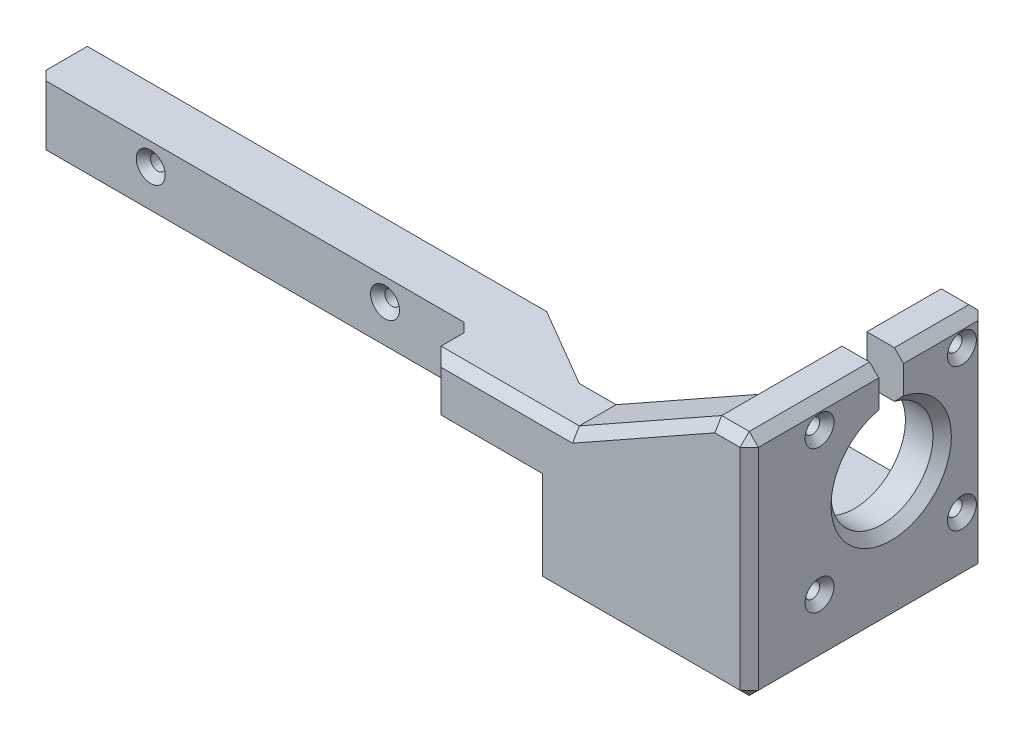
from build123d import *

# Parameters (mm, degrees)
SKETCH1_W           = 100
SKETCH1_H           = 13
SKETCH1_R           = 1.6
BOSS_EXTRUDE1_DEPTH = 10
SKETCH2_R           = 1.6
BOSS_EXTRUDE2_DEPTH = 10
SKETCH4_R           = 1.6
SKETCH4_R_2         = 11.1
BOSS_EXTRUDE3_DEPTH = 8
SKETCH5_W           = 47
SKETCH5_H           = 51.8
BOSS_EXTRUDE4_DEPTH = 8
SKETCH6_W           = 39
SKETCH6_H           = 11.35
BOSS_EXTRUDE5_DEPTH = 10
BOSS_EXTRUDE6_DEPTH = 8
SKETCH8_W           = 10
SKETCH8_H           = 10
BOSS_EXTRUDE7_DEPTH = 2.15
CHAMFER1_SIZE2      = 17.09924405
CHAMFER1_SIZE       = 10
CHAMFER3_SIZE       = 2
CHAMFER4_SIZE       = 3
CHAMFER5_SIZE       = 1.55
SKETCH9_W           = 95
SKETCH9_H           = 9
CUT_EXTRUDE1_DEPTH  = 126.670601176
CHAMFER6_SIZE       = 1.55
CHAMFER7_SIZE       = 2
SKETCH11_W          = 47
SKETCH11_H          = 8
CUT_EXTRUDE3_DEPTH  = 132.535746092
CUT_EXTRUDE4_DEPTH  = 170.481709928
CHAMFER9_SIZE       = 2


# Some blends are built 0.0001 mm under size
with BuildPart() as part:
    # Sketch1 → Boss-Extrude1 (new body)
    with BuildSketch(Plane.XY):
        Rectangle(SKETCH1_W, SKETCH1_H)
        with Locations((25.8, 1.7)):
            Circle(SKETCH1_R, mode=Mode.SUBTRACT)
        with Locations((-25.2, 1.7)):
            Circle(SKETCH1_R, mode=Mode.SUBTRACT)
    extrude(amount=BOSS_EXTRUDE1_DEPTH)

    # Sketch2 → Boss-Extrude2 (add)
    with BuildSketch(Plane.XY.offset(10)):
        Polygon((50, -6.5), (106.1, -6.5), (106.1, 6.5), (50, 6.5), (-50, 6.5), (-50, -6.5), align=None)
        with Locations((25.8, 1.7)):
            Circle(SKETCH2_R, mode=Mode.SUBTRACT)
        with Locations((-25.2, 1.7)):
            Circle(SKETCH2_R, mode=Mode.SUBTRACT)
    extrude(amount=BOSS_EXTRUDE2_DEPTH)

    # Sketch4 → Boss-Extrude3 (add)
    with BuildSketch(Plane(origin=(106.1, 0, 0), x_dir=(0, 0, -1), z_dir=(1, 0, 0))):
        Polygon((-20, -6.5), (-20, -17.85), (31.8, -17.85), (31.8, 23.95), (-20, 23.95), align=None)
        with Locations((-4.7, 18.55)):
            Circle(SKETCH4_R, mode=Mode.SUBTRACT)
        with Locations(Location((26.3, 18.55, 0), (0, 0, 180))):
            Circle(SKETCH4_R, mode=Mode.SUBTRACT)
        with Locations((26.3, -12.45)):
            Circle(SKETCH4_R, mode=Mode.SUBTRACT)
        with Locations(Location((-4.7, -12.45, 0), (0, 0, 180))):
            Circle(SKETCH4_R, mode=Mode.SUBTRACT)
        with Locations((10.9, 3.05)):
            Circle(SKETCH4_R_2, mode=Mode.SUBTRACT)
    extrude(amount=BOSS_EXTRUDE3_DEPTH)

    # Sketch5 → Boss-Extrude4 (add)
    with BuildSketch(Plane.XZ.offset(17.85)):
        with Locations((90.6, -5.9)):
            Rectangle(SKETCH5_W, SKETCH5_H)
    extrude(amount=BOSS_EXTRUDE4_DEPTH)

    # Sketch6 → Boss-Extrude5 (add)
    with BuildSketch(Plane.XY.offset(20)):
        Polygon((106.1, 23.95), (75.1, 6.5), (106.1, 6.5), align=None)
        with Locations((86.6, -12.175)):
            Rectangle(SKETCH6_W, SKETCH6_H)
    extrude(amount=-BOSS_EXTRUDE5_DEPTH)

    # Sketch7 → Boss-Extrude6 (add)
    with BuildSketch(Plane(origin=(0, 0, -31.8), x_dir=(-1, 0, 0), z_dir=(0, 0, -1))):
        Polygon((-67.1, -17.85), (-67.1, -6.5), (-67.1, 1.996774194), (-106.1, 23.95), (-114.1, 23.95), (-114.1, -25.85), (-67.1, -25.85), align=None)
    extrude(amount=BOSS_EXTRUDE6_DEPTH)

    # Sketch8 → Boss-Extrude7 (add)
    with BuildSketch(Plane.XZ.offset(25.85)):
        with Locations((78.85, 7.05)):
            Rectangle(SKETCH8_W, SKETCH8_H)
        with Locations((102.35, 7.05)):
            Rectangle(SKETCH8_W, SKETCH8_H)
        with Locations((102.35, -18.85)):
            Rectangle(SKETCH8_W, SKETCH8_H)
        with Locations((78.85, -18.85)):
            Rectangle(SKETCH8_W, SKETCH8_H)
    extrude(amount=BOSS_EXTRUDE7_DEPTH)

    # Chamfer1
    chamfer1_edges = [part.edges().sort_by_distance(p)[0] for p in [
        (50, 0, 10),
    ]]
    chamfer1_side = [part.faces().sort_by_distance(p)[0] for p in [
        (50, 0, 9.8),
    ]]
    chamfer(chamfer1_edges, length=CHAMFER1_SIZE - 0.0001, length2=CHAMFER1_SIZE2 - 0.0001, reference=chamfer1_side[0])  # a hair under: the kernel refuses the full size

    # Chamfer3
    chamfer3_edges = [part.edges().sort_by_distance(p)[0] for p in [
        (86.6, 12.973387097, -39.8),
        (110.1, 23.95, -39.8),
        (114.1, -0.95, -39.8),
        (90.6, -25.85, -39.8),
        (-50, 0, 20),
        (114.1, -0.95, 20),
        (114.1, 23.95, -9.9),
        (110.1, 23.95, 20),
        (114.1, 3.05, 0.2),
        (67.1, -16.175, 20),
        (114.1, -25.85, -9.9),
        (90.6, -25.85, 20),
    ]]
    chamfer(chamfer3_edges, length=CHAMFER3_SIZE)

    # Chamfer4
    # the kernel refuses this chamfer: 3 mm, written as the material it takes off along each edge
    with BuildSketch(Plane(origin=(115.065048964, -28, 2.05), x_dir=(0, -0.027495876610586775, 0.9996219169112968), z_dir=(-1, 0, 0))) as chamfer4_piece_1_section:
        Polygon((CHAMFER4_SIZE * 0.999621916911, CHAMFER4_SIZE * 0.0274958766106), (-CHAMFER4_SIZE * 0.0274958766106, CHAMFER4_SIZE * 0.999621916911), (0, 0), align=None)
    chamfer4_piece_1 = extrude(amount=25.430097928, mode=Mode.PRIVATE)
    chamfer4_piece_1 = split(chamfer4_piece_1, bisect_by=Plane(origin=(102.35, -25.85, 3.119652888), z_dir=(0, -1, 0)), keep=Keep.TOP, mode=Mode.PRIVATE)
    add(chamfer4_piece_1, mode=Mode.SUBTRACT)
    with BuildSketch(Plane(origin=(97.35, -28, -5.665048964), x_dir=(0.9996219169112965, -0.02749587661058676, 0), z_dir=(0, 0, 1))) as chamfer4_piece_2_section:
        Polygon((CHAMFER4_SIZE * 0.999621916911, CHAMFER4_SIZE * 0.0274958766106), (-CHAMFER4_SIZE * 0.0274958766106, CHAMFER4_SIZE * 0.999621916911), (0, 0), align=None)
    chamfer4_piece_2 = extrude(amount=25.430097928, mode=Mode.PRIVATE)
    chamfer4_piece_2 = split(chamfer4_piece_2, bisect_by=Plane(origin=(98.419652888, -25.85, 7.05), z_dir=(0, -1, 0)), keep=Keep.TOP, mode=Mode.PRIVATE)
    add(chamfer4_piece_2, mode=Mode.SUBTRACT)
    with BuildSketch(Plane(origin=(89.634951036, -28, 12.05), x_dir=(0, -0.02749587661058678, -0.9996219169112968), z_dir=(1, 0, 0))) as chamfer4_piece_3_section:
        Polygon((CHAMFER4_SIZE * 0.999621916911, CHAMFER4_SIZE * 0.0274958766106), (-CHAMFER4_SIZE * 0.0274958766106, CHAMFER4_SIZE * 0.999621916911), (0, 0), align=None)
    chamfer4_piece_3 = extrude(amount=25.430097928, mode=Mode.PRIVATE)
    chamfer4_piece_3 = split(chamfer4_piece_3, bisect_by=Plane(origin=(102.35, -25.85, 10.980347112), z_dir=(0, -1, 0)), keep=Keep.TOP, mode=Mode.PRIVATE)
    add(chamfer4_piece_3, mode=Mode.SUBTRACT)
    with BuildSketch(Plane(origin=(107.35, -28, 19.765048964), x_dir=(0.027495876610586768, 0.9996219169112968, 0), z_dir=(0, 0, -1))) as chamfer4_piece_4_section:
        Polygon((CHAMFER4_SIZE * 0.999621916911, -CHAMFER4_SIZE * 0.0274958766106), (-CHAMFER4_SIZE * 0.0274958766106, -CHAMFER4_SIZE * 0.999621916911), (0, 0), align=None)
    chamfer4_piece_4 = extrude(amount=25.430097928, mode=Mode.PRIVATE)
    chamfer4_piece_4 = split(chamfer4_piece_4, bisect_by=Plane(origin=(106.280347112, -25.85, 7.05), z_dir=(0, -1, 0)), keep=Keep.TOP, mode=Mode.PRIVATE)
    add(chamfer4_piece_4, mode=Mode.SUBTRACT)
    with BuildSketch(Plane(origin=(91.565048964, -28, 2.05), x_dir=(0, -0.027495876610586775, 0.9996219169112968), z_dir=(-1, 0, 0))) as chamfer4_piece_5_section:
        Polygon((CHAMFER4_SIZE * 0.999621916911, CHAMFER4_SIZE * 0.0274958766106), (-CHAMFER4_SIZE * 0.0274958766106, CHAMFER4_SIZE * 0.999621916911), (0, 0), align=None)
    chamfer4_piece_5 = extrude(amount=25.430097928, mode=Mode.PRIVATE)
    chamfer4_piece_5 = split(chamfer4_piece_5, bisect_by=Plane(origin=(78.85, -25.85, 3.119652888), z_dir=(0, -1, 0)), keep=Keep.TOP, mode=Mode.PRIVATE)
    add(chamfer4_piece_5, mode=Mode.SUBTRACT)
    with BuildSketch(Plane(origin=(73.85, -28, -5.665048964), x_dir=(-0.027495876610586768, 0.9996219169112968, 0), z_dir=(0, 0, 1))) as chamfer4_piece_6_section:
        Polygon((CHAMFER4_SIZE * 0.999621916911, -CHAMFER4_SIZE * 0.0274958766106), (-CHAMFER4_SIZE * 0.0274958766106, -CHAMFER4_SIZE * 0.999621916911), (0, 0), align=None)
    chamfer4_piece_6 = extrude(amount=25.430097928, mode=Mode.PRIVATE)
    chamfer4_piece_6 = split(chamfer4_piece_6, bisect_by=Plane(origin=(74.919652888, -25.85, 7.05), z_dir=(0, -1, 0)), keep=Keep.TOP, mode=Mode.PRIVATE)
    add(chamfer4_piece_6, mode=Mode.SUBTRACT)
    with BuildSketch(Plane(origin=(66.134951036, -28, 12.05), x_dir=(0, -0.02749587661058678, -0.9996219169112968), z_dir=(1, 0, 0))) as chamfer4_piece_7_section:
        Polygon((CHAMFER4_SIZE * 0.999621916911, CHAMFER4_SIZE * 0.0274958766106), (-CHAMFER4_SIZE * 0.0274958766106, CHAMFER4_SIZE * 0.999621916911), (0, 0), align=None)
    chamfer4_piece_7 = extrude(amount=25.430097928, mode=Mode.PRIVATE)
    chamfer4_piece_7 = split(chamfer4_piece_7, bisect_by=Plane(origin=(78.85, -25.85, 10.980347112), z_dir=(0, -1, 0)), keep=Keep.TOP, mode=Mode.PRIVATE)
    add(chamfer4_piece_7, mode=Mode.SUBTRACT)
    with BuildSketch(Plane(origin=(83.85, -28, 19.765048964), x_dir=(-0.9996219169112965, -0.02749587661058676, 0), z_dir=(0, 0, -1))) as chamfer4_piece_8_section:
        Polygon((CHAMFER4_SIZE * 0.999621916911, CHAMFER4_SIZE * 0.0274958766106), (-CHAMFER4_SIZE * 0.0274958766106, CHAMFER4_SIZE * 0.999621916911), (0, 0), align=None)
    chamfer4_piece_8 = extrude(amount=25.430097928, mode=Mode.PRIVATE)
    chamfer4_piece_8 = split(chamfer4_piece_8, bisect_by=Plane(origin=(82.780347112, -25.85, 7.05), z_dir=(0, -1, 0)), keep=Keep.TOP, mode=Mode.PRIVATE)
    add(chamfer4_piece_8, mode=Mode.SUBTRACT)
    with BuildSketch(Plane(origin=(97.35, -28, -6.134951036), x_dir=(0.9996219169112965, -0.02749587661058676, 0), z_dir=(0, 0, -1))) as chamfer4_piece_9_section:
        Polygon((CHAMFER4_SIZE * 0.999621916911, -CHAMFER4_SIZE * 0.0274958766106), (-CHAMFER4_SIZE * 0.0274958766106, -CHAMFER4_SIZE * 0.999621916911), (0, 0), align=None)
    chamfer4_piece_9 = extrude(amount=25.430097928, mode=Mode.PRIVATE)
    chamfer4_piece_9 = split(chamfer4_piece_9, bisect_by=Plane(origin=(98.419652888, -25.85, -18.85), z_dir=(0, -1, 0)), keep=Keep.TOP, mode=Mode.PRIVATE)
    add(chamfer4_piece_9, mode=Mode.SUBTRACT)
    with BuildSketch(Plane(origin=(115.065048964, -28, -13.85), x_dir=(0, -0.027495876610586768, -0.9996219169112968), z_dir=(-1, 0, 0))) as chamfer4_piece_10_section:
        Polygon((CHAMFER4_SIZE * 0.999621916911, -CHAMFER4_SIZE * 0.0274958766106), (-CHAMFER4_SIZE * 0.0274958766106, -CHAMFER4_SIZE * 0.999621916911), (0, 0), align=None)
    chamfer4_piece_10 = extrude(amount=25.430097928, mode=Mode.PRIVATE)
    chamfer4_piece_10 = split(chamfer4_piece_10, bisect_by=Plane(origin=(102.35, -25.85, -14.919652888), z_dir=(0, -1, 0)), keep=Keep.TOP, mode=Mode.PRIVATE)
    add(chamfer4_piece_10, mode=Mode.SUBTRACT)
    with BuildSketch(Plane(origin=(107.35, -28, -31.565048964), x_dir=(0.027495876610586768, 0.9996219169112968, 0), z_dir=(0, 0, 1))) as chamfer4_piece_11_section:
        Polygon((CHAMFER4_SIZE * 0.999621916911, CHAMFER4_SIZE * 0.0274958766106), (-CHAMFER4_SIZE * 0.0274958766106, CHAMFER4_SIZE * 0.999621916911), (0, 0), align=None)
    chamfer4_piece_11 = extrude(amount=25.430097928, mode=Mode.PRIVATE)
    chamfer4_piece_11 = split(chamfer4_piece_11, bisect_by=Plane(origin=(106.280347112, -25.85, -18.85), z_dir=(0, -1, 0)), keep=Keep.TOP, mode=Mode.PRIVATE)
    add(chamfer4_piece_11, mode=Mode.SUBTRACT)
    with BuildSketch(Plane(origin=(89.634951036, -28, -23.85), x_dir=(0, -0.027495876610586768, 0.9996219169112968), z_dir=(1, 0, 0))) as chamfer4_piece_12_section:
        Polygon((CHAMFER4_SIZE * 0.999621916911, -CHAMFER4_SIZE * 0.0274958766106), (-CHAMFER4_SIZE * 0.0274958766106, -CHAMFER4_SIZE * 0.999621916911), (0, 0), align=None)
    chamfer4_piece_12 = extrude(amount=25.430097928, mode=Mode.PRIVATE)
    chamfer4_piece_12 = split(chamfer4_piece_12, bisect_by=Plane(origin=(102.35, -25.85, -22.780347112), z_dir=(0, -1, 0)), keep=Keep.TOP, mode=Mode.PRIVATE)
    add(chamfer4_piece_12, mode=Mode.SUBTRACT)
    with BuildSketch(Plane(origin=(66.134951036, -28, -13.85), x_dir=(0, -0.027495876610586768, -0.9996219169112968), z_dir=(1, 0, 0))) as chamfer4_piece_13_section:
        Polygon((CHAMFER4_SIZE * 0.999621916911, CHAMFER4_SIZE * 0.0274958766106), (-CHAMFER4_SIZE * 0.0274958766106, CHAMFER4_SIZE * 0.999621916911), (0, 0), align=None)
    chamfer4_piece_13 = extrude(amount=25.430097928, mode=Mode.PRIVATE)
    chamfer4_piece_13 = split(chamfer4_piece_13, bisect_by=Plane(origin=(78.85, -25.85, -14.919652888), z_dir=(0, -1, 0)), keep=Keep.TOP, mode=Mode.PRIVATE)
    add(chamfer4_piece_13, mode=Mode.SUBTRACT)
    with BuildSketch(Plane(origin=(83.85, -28, -6.134951036), x_dir=(-0.9996219169112965, -0.02749587661058676, 0), z_dir=(0, 0, -1))) as chamfer4_piece_14_section:
        Polygon((CHAMFER4_SIZE * 0.999621916911, CHAMFER4_SIZE * 0.0274958766106), (-CHAMFER4_SIZE * 0.0274958766106, CHAMFER4_SIZE * 0.999621916911), (0, 0), align=None)
    chamfer4_piece_14 = extrude(amount=25.430097928, mode=Mode.PRIVATE)
    chamfer4_piece_14 = split(chamfer4_piece_14, bisect_by=Plane(origin=(82.780347112, -25.85, -18.85), z_dir=(0, -1, 0)), keep=Keep.TOP, mode=Mode.PRIVATE)
    add(chamfer4_piece_14, mode=Mode.SUBTRACT)
    with BuildSketch(Plane(origin=(91.565048964, -28, -23.85), x_dir=(0, -0.027495876610586768, 0.9996219169112968), z_dir=(-1, 0, 0))) as chamfer4_piece_15_section:
        Polygon((CHAMFER4_SIZE * 0.999621916911, CHAMFER4_SIZE * 0.0274958766106), (-CHAMFER4_SIZE * 0.0274958766106, CHAMFER4_SIZE * 0.999621916911), (0, 0), align=None)
    chamfer4_piece_15 = extrude(amount=25.430097928, mode=Mode.PRIVATE)
    chamfer4_piece_15 = split(chamfer4_piece_15, bisect_by=Plane(origin=(78.85, -25.85, -22.780347112), z_dir=(0, -1, 0)), keep=Keep.TOP, mode=Mode.PRIVATE)
    add(chamfer4_piece_15, mode=Mode.SUBTRACT)
    with BuildSketch(Plane(origin=(73.85, -28, -31.565048964), x_dir=(-0.027495876610586768, 0.9996219169112968, 0), z_dir=(0, 0, 1))) as chamfer4_piece_16_section:
        Polygon((CHAMFER4_SIZE * 0.999621916911, -CHAMFER4_SIZE * 0.0274958766106), (-CHAMFER4_SIZE * 0.0274958766106, -CHAMFER4_SIZE * 0.999621916911), (0, 0), align=None)
    chamfer4_piece_16 = extrude(amount=25.430097928, mode=Mode.PRIVATE)
    chamfer4_piece_16 = split(chamfer4_piece_16, bisect_by=Plane(origin=(74.919652888, -25.85, -18.85), z_dir=(0, -1, 0)), keep=Keep.TOP, mode=Mode.PRIVATE)
    add(chamfer4_piece_16, mode=Mode.SUBTRACT)

    # Chamfer5
    chamfer5_edges = [part.edges().sort_by_distance(p)[0] for p in [
        (114.1, 18.55, 6.3),
        (114.1, 18.55, -27.9),
        (114.1, -12.45, -24.7),
        (114.1, -12.45, 3.1),
    ]]
    chamfer(chamfer5_edges, length=CHAMFER5_SIZE)

    # Sketch9 → Cut-Extrude1 (cut, through all)
    with BuildSketch(Plane(origin=(0, 6.5, 0), x_dir=(1, 0, 0), z_dir=(0, 1, 0))):
        with Locations((-2.5, -15.5)):
            Rectangle(SKETCH9_W, SKETCH9_H)
    extrude(amount=-CUT_EXTRUDE1_DEPTH, mode=Mode.SUBTRACT)

    # Chamfer6
    chamfer6_edges = [part.edges().sort_by_distance(p)[0] for p in [
        (24.2, 1.7, 11),
        (-26.8, 1.7, 11),
    ]]
    chamfer(chamfer6_edges, length=CHAMFER6_SIZE)

    # Chamfer7
    chamfer7_edges = [part.edges().sort_by_distance(p)[0] for p in [
        (45, 0, 20),
        (45, 0, 11),
        (-50, 0, 11),
        (88.823495702, 14.225, 20),
        (57.05, -6.5, 20),
        (60.05, 6.5, 20),
    ]]
    chamfer(chamfer7_edges, length=CHAMFER7_SIZE)

    # Sketch11 → Cut-Extrude3 (cut, through all)
    with BuildSketch(Plane(origin=(0, 23.95, 0), x_dir=(1, 0, 0), z_dir=(0, 1, 0))):
        with Locations((90.6, 35.8)):
            Rectangle(SKETCH11_W, SKETCH11_H)
    extrude(amount=-CUT_EXTRUDE3_DEPTH, mode=Mode.SUBTRACT)

    # Sketch13 → Cut-Extrude4 (cut, through all)
    with BuildSketch(Plane(origin=(114.1, 0, 0), x_dir=(0, 0, -1), z_dir=(1, 0, 0))):
        with BuildLine():
            Line((13.6, 13.816615067), (13.6, 23.95))
            Line((13.6, 23.95), (8.2, 23.95))
            Line((8.2, 23.95), (8.2, 13.816615067))
            ThreePointArc((8.2, 13.816615067), (10.9, 14.15), (13.6, 13.816615067))
        make_face()
    extrude(amount=-CUT_EXTRUDE4_DEPTH, mode=Mode.SUBTRACT)

    # Chamfer9
    # the kernel refuses this chamfer: 2 mm, written as the material it takes off along each edge
    with BuildSketch(Plane(origin=(67.1, -12.706634024, -31.8), x_dir=(0.9996219169112968, 0, -0.02749587661058555), z_dir=(0, -1, 0))) as chamfer9_piece_1:
        Polygon((CHAMFER9_SIZE * 0.999621916911, CHAMFER9_SIZE * 0.0274958766106), (-CHAMFER9_SIZE * 0.0274958766106, CHAMFER9_SIZE * 0.999621916911), (0, 0), align=None)
    extrude(amount=18.286731952, mode=Mode.SUBTRACT)
    with BuildSketch(Plane(origin=(100.956634024, 23.95, -31.8), x_dir=(0, 0.027495876610585647, 0.9996219169112968), z_dir=(1, 0, 0))) as chamfer9_piece_2:
        Polygon((CHAMFER9_SIZE * 0.999621916911, CHAMFER9_SIZE * 0.0274958766106), (-CHAMFER9_SIZE * 0.0274958766106, CHAMFER9_SIZE * 0.999621916911), (0, 0), align=None)
    extrude(amount=16.286731952, mode=Mode.SUBTRACT)
    with BuildSketch(Plane(origin=(114.1, 27.093365976, -31.8), x_dir=(0.0274958766105891, 0, 0.9996219169112968), z_dir=(0, -1, 0))) as chamfer9_piece_3:
        Polygon((CHAMFER9_SIZE * 0.999621916911, CHAMFER9_SIZE * 0.0274958766106), (-CHAMFER9_SIZE * 0.0274958766106, CHAMFER9_SIZE * 0.999621916911), (0, 0), align=None)
    extrude(amount=56.086731952, mode=Mode.SUBTRACT)


solid = part.part
